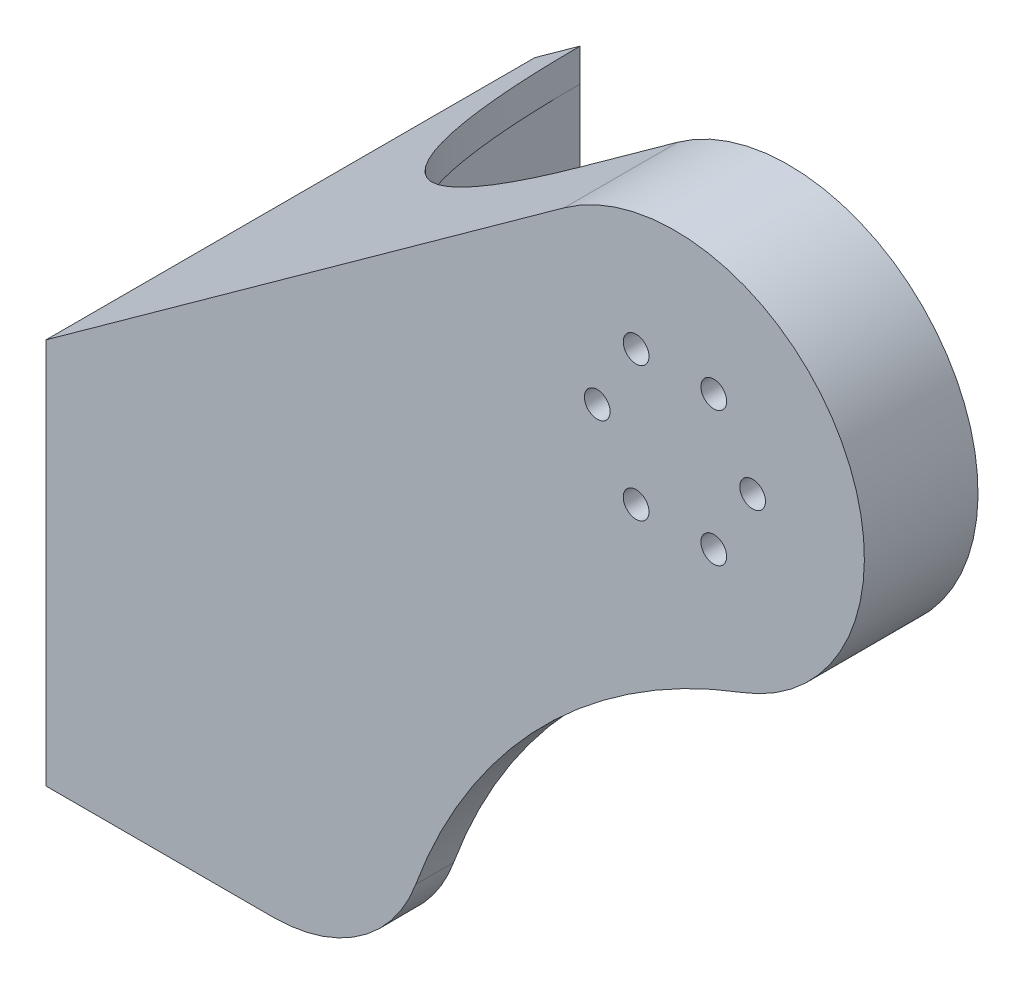
from build123d import *

# Parameters (mm, degrees)
SKIZZE1_R                        = 1.7
AUFSATZ_LINEAR_AUSTRAGEN1_DEPTH  = 5
SKIZZE14_R                       = 25
SKIZZE14_R_2                     = 19
AUFSATZ_LINEAR_AUSTRAGEN9_DEPTH  = 10
SKIZZE4_W                        = 59.5
SKIZZE4_H                        = 51
SKIZZE4_R                        = 1.7
SKIZZE4_R_2                      = 19
AUFSATZ_LINEAR_AUSTRAGEN4_DEPTH  = 6
AUFSATZ_LINEAR_START             = -64.5
AUFSATZ_LINEAR_AUSTRAGEN10_DEPTH = 59.5
AUFSATZ_LINEAR_AUSTRAGEN11_DEPTH = 59.5
SCHNITT_LINEAR_AUSTRAGEN4_DEPTH  = 146.774654862
SKIZZE19_R                       = 67.170138889
SCHNITT_LINEAR_AUSTRAGEN5_DEPTH  = 146.774654862


# Read off the part's stored shape, not the designer's step: Aufsatz-Linear austragen10
with BuildPart() as part:
    # Skizze1 → Aufsatz-Linear austragen1 (new body)
    with BuildSketch(Plane.XY):
        with BuildLine():
            Line((-83, -29), (-83, -80))
            Line((-83, -80), (-53, -80))
            ThreePointArc((-53, -80), (-41.528471273, -76.383040886), (-34.206147584, -66.840402867))
            ThreePointArc((-34.206147584, -66.840402867), (-17.465018587, -40.413653136), (8.789632026, -23.403896446))
            ThreePointArc((8.789632026, -23.403896446), (22.036349892, 11.806747369), (-14.616570826, 20.281909606))
            Line((-14.616570826, 20.281909606), (-83, -29))
        make_face()
        with Locations((10.25, 0)):
            Circle(SKIZZE1_R, mode=Mode.SUBTRACT)
        with Locations((5.125, -8.876760389)):
            Circle(SKIZZE1_R, mode=Mode.SUBTRACT)
        with Locations((-5.125, -8.876760389)):
            Circle(SKIZZE1_R, mode=Mode.SUBTRACT)
        with Locations((-10.25, 0)):
            Circle(SKIZZE1_R, mode=Mode.SUBTRACT)
        with Locations((-5.125, 8.876760389)):
            Circle(SKIZZE1_R, mode=Mode.SUBTRACT)
        with Locations((5.125, 8.876760389)):
            Circle(SKIZZE1_R, mode=Mode.SUBTRACT)
    extrude(amount=-AUFSATZ_LINEAR_AUSTRAGEN1_DEPTH)

    # Skizze14 → Aufsatz-Linear austragen9 (add)
    with BuildSketch(Plane(origin=(0, 0, -5), x_dir=(-1, 0, 0), z_dir=(0, 0, -1))):
        with Locations(Location((0, 0, 0), (0, 0, 249.415691324))):
            Circle(SKIZZE14_R)
        Circle(SKIZZE14_R_2, mode=Mode.SUBTRACT)
    extrude(amount=AUFSATZ_LINEAR_AUSTRAGEN9_DEPTH)

    # Skizze4 → Aufsatz-Linear austragen4 (add)
    with BuildSketch(Plane.ZY.offset(83)):
        with Locations((-34.75, -54.5)):
            Rectangle(SKIZZE4_W, SKIZZE4_H)
        with Locations((-24, -39)):
            Circle(SKIZZE4_R, mode=Mode.SUBTRACT)
        with Locations((-55, -39)):
            Circle(SKIZZE4_R, mode=Mode.SUBTRACT)
        with Locations((-55, -70)):
            Circle(SKIZZE4_R, mode=Mode.SUBTRACT)
        with Locations((-24, -70)):
            Circle(SKIZZE4_R, mode=Mode.SUBTRACT)
        with Locations((-39.5, -54.5)):
            Circle(SKIZZE4_R_2, mode=Mode.SUBTRACT)
    extrude(amount=-AUFSATZ_LINEAR_AUSTRAGEN4_DEPTH)

    # Aufsatz-Linear austragen10 outline → Aufsatz-Linear austragen10 (add)
    with BuildSketch(Plane.XY.offset(AUFSATZ_LINEAR_START)):
        with BuildLine():
            Line((-77, -76), (-77, -80))
            Line((-77, -80), (-53, -80))
            ThreePointArc((-53, -80), (-46.67544468, -78.973665961), (-41, -76))
            Line((-41, -76), (-77, -76))
        make_face()
    extrude(amount=AUFSATZ_LINEAR_AUSTRAGEN10_DEPTH)

    # Skizze16 → Aufsatz-Linear austragen11 (add)
    with BuildSketch(Plane(origin=(0, 0, -5), x_dir=(-1, 0, 0), z_dir=(0, 0, -1))):
        Polygon((83, -29), (14.616570826, 20.281909606), (12.565587056, 17.435970711), (77, -29), align=None)
    extrude(amount=AUFSATZ_LINEAR_AUSTRAGEN11_DEPTH)

    # Skizze18 → Schnitt-Linear austragen4 (cut, through all)
    with BuildSketch(Plane(origin=(0, -76, 0), x_dir=(1, 0, 0), z_dir=(0, 1, 0))):
        with BuildLine():
            Line((25, 15), (25, 103.581922368))
            Line((25, 103.581922368), (-57.878501345, 103.581922368))
            ThreePointArc((-57.878501345, 103.581922368), (-74.323098772, 48.442371863), (-27.5, 15))
            Line((-27.5, 15), (25, 15))
        make_face()
    extrude(amount=SCHNITT_LINEAR_AUSTRAGEN4_DEPTH, mode=Mode.SUBTRACT)

    # Skizze19 → Schnitt-Linear austragen5 (cut, through all)
    with BuildSketch(Plane(origin=(0, -76, 0), x_dir=(1, 0, 0), z_dir=(0, 1, 0))):
        with Locations((-9.829861111, 64.5)):
            Circle(SKIZZE19_R)
    extrude(amount=-SCHNITT_LINEAR_AUSTRAGEN5_DEPTH, mode=Mode.SUBTRACT)


solid = part.part
